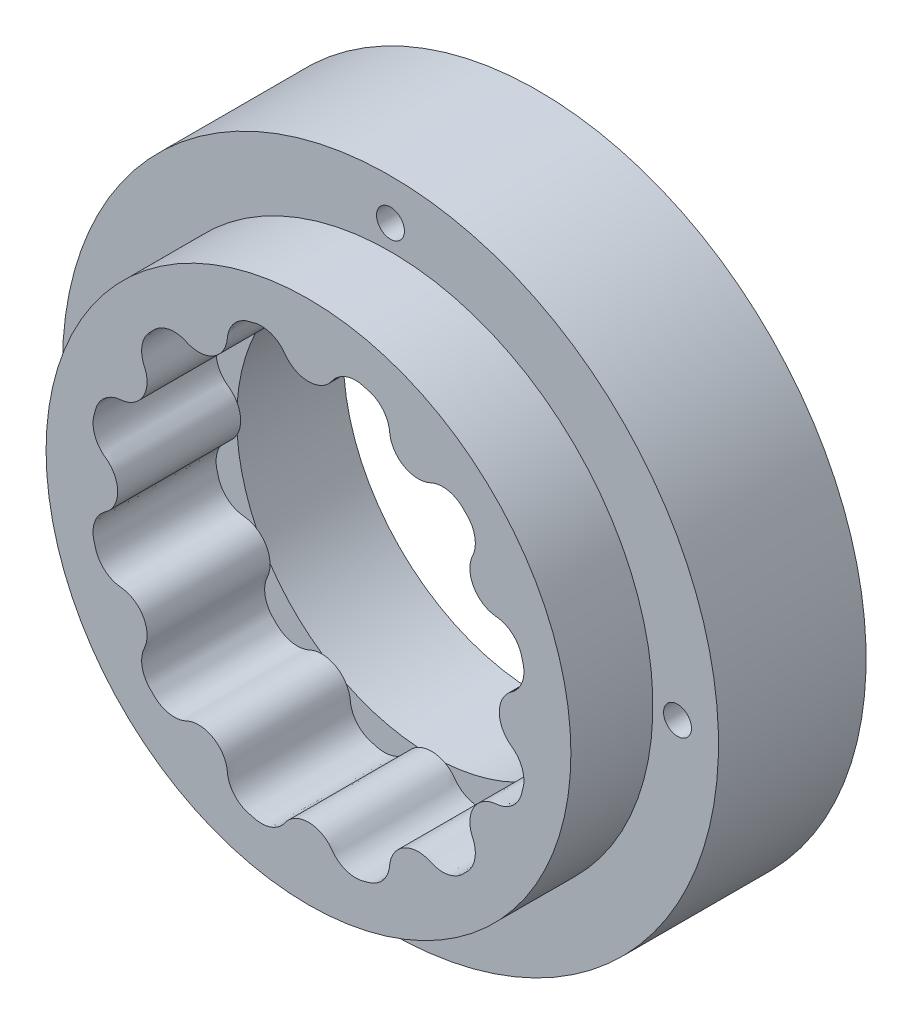
from build123d import *

# Parameters (mm, degrees)
SKETCH1_R           = 32
BOSS_EXTRUDE1_DEPTH = 15
SKETCH3_R           = 40
SKETCH3_R_2         = 30
BOSS_EXTRUDE3_DEPTH = 5
BOSS_EXTRUDE4_START = 13
SKETCH4_R           = 40
SKETCH4_R_2         = 23.75
BOSS_EXTRUDE4_DEPTH = 13
SKETCH5_R           = 1.7
CUT_EXTRUDE1_DEPTH  = 20


with BuildPart() as part:
    # Sketch1 → Boss-Extrude1 (new body)
    with BuildSketch(Plane.XY):
        Circle(SKETCH1_R)
        with BuildLine():
            add(Edge.make_bspline(
                [(7.359163775, -25.96214424), (8.80703283, -25.551734938), (9.765467005, -24.39149163), (9.895150008, -22.892177482), (9.895211407, -22.891467624), (9.895333772, -22.890047872), (9.895515919, -22.887918123), (9.895638291, -22.886498372), (9.895699694, -22.885788515), (10.126492204, -20.21767536), (12.445774365, -18.87863718), (14.871824392, -20.012821581), (14.872469848, -20.013123333), (14.873760575, -20.013727231), (14.875696065, -20.014634362), (14.876986789, -20.015238266), (14.877632243, -20.015540022), (16.224842042, -20.645372719), (17.692884513, -20.407644368), (18.772471398, -19.384826874), (18.779572215, -19.378099449), (18.793717523, -19.364585146), (18.814759116, -19.344129638), (18.828775539, -19.330481949), (18.835780038, -19.323654296), (19.000479487, -19.1631131), (19.1631131, -19.000479487), (19.323654296, -18.835780038), (19.330481949, -18.828775539), (19.344129638, -18.814759116), (19.364585146, -18.793717523), (19.378099449, -18.779572215), (19.384826874, -18.772471398), (20.407644368, -17.692884513), (20.645372719, -16.224842042), (20.015540022, -14.877632243), (20.015238266, -14.876986789), (20.014634362, -14.875696065), (20.013727231, -14.873760575), (20.013123333, -14.872469848), (20.012821581, -14.871824392), (18.87863718, -12.445774365), (20.21767536, -10.126492204), (22.885788515, -9.895699694), (22.886498372, -9.895638291), (22.887918123, -9.895515919), (22.890047872, -9.895333772), (22.891467624, -9.895211407), (22.892177482, -9.895150008), (24.37381174, -9.766996225), (25.526309639, -8.827096198), (25.949850559, -7.401516822), (25.952636335, -7.392140292), (25.958129379, -7.373363908), (25.966124179, -7.345128123), (25.971438913, -7.326300666), (25.974091161, -7.316885495), (26.036454469, -7.095503016), (26.095982503, -6.87334137), (26.152665533, -6.650436865), (26.155076205, -6.640956964), (26.159887239, -6.621994541), (26.167081431, -6.593544234), (26.171712507, -6.574536886), (26.17398822, -6.565023685), (26.519980711, -5.118665271), (25.991838266, -3.728439021), (24.772782251, -2.87663746), (24.772198196, -2.876229358), (24.771029837, -2.87541351), (24.769276494, -2.874190893), (24.768108139, -2.873375039), (24.767524086, -2.872966934), (22.572266569, -1.33903818), (22.572266569, 1.33903818), (24.767524086, 2.872966934), (24.768108139, 2.873375039), (24.769276494, 2.874190893), (24.771029837, 2.87541351), (24.772198196, 2.876229358), (24.772782251, 2.87663746), (25.991838266, 3.728439021), (26.519980711, 5.118665271), (26.17398822, 6.565023685), (26.171712507, 6.574536886), (26.167081431, 6.593544234), (26.159887239, 6.621994541), (26.155076205, 6.640956964), (26.152665533, 6.650436865), (26.095982503, 6.87334137), (26.036454469, 7.095503016), (25.974091161, 7.316885495), (25.971438913, 7.326300666), (25.966124179, 7.345128123), (25.958129379, 7.373363908), (25.952636335, 7.392140292), (25.949850559, 7.401516822), (25.526309639, 8.827096198), (24.37381174, 9.766996225), (22.892177482, 9.895150008), (22.891467624, 9.895211407), (22.890047872, 9.895333772), (22.887918123, 9.895515919), (22.886498372, 9.895638291), (22.885788515, 9.895699694), (20.21767536, 10.126492204), (18.87863718, 12.445774365), (20.012821581, 14.871824392), (20.013123333, 14.872469848), (20.013727231, 14.873760575), (20.014634362, 14.875696065), (20.015238266, 14.876986789), (20.015540022, 14.877632243), (20.645372719, 16.224842042), (20.407644368, 17.692884513), (19.384826874, 18.772471398), (19.378099449, 18.779572215), (19.364585146, 18.793717523), (19.344129638, 18.814759116), (19.330481949, 18.828775539), (19.323654296, 18.835780038), (19.1631131, 19.000479487), (19.000479487, 19.1631131), (18.835780038, 19.323654296), (18.828775539, 19.330481949), (18.814759116, 19.344129638), (18.793717523, 19.364585146), (18.779572215, 19.378099449), (18.772471398, 19.384826874), (17.692884513, 20.407644368), (16.224842042, 20.645372719), (14.877632243, 20.015540022), (14.876986789, 20.015238266), (14.875696065, 20.014634362), (14.873760575, 20.013727231), (14.872469848, 20.013123333), (14.871824392, 20.012821581), (12.445774365, 18.87863718), (10.126492204, 20.21767536), (9.895699694, 22.885788515), (9.895638291, 22.886498372), (9.895515919, 22.887918123), (9.895333772, 22.890047872), (9.895211407, 22.891467624), (9.895150008, 22.892177482), (9.766996225, 24.37381174), (8.827096198, 25.526309639), (7.401516822, 25.949850559), (7.392140292, 25.952636335), (7.373363908, 25.958129379), (7.345128123, 25.966124179), (7.326300666, 25.971438913), (7.316885495, 25.974091161), (7.095503016, 26.036454469), (6.87334137, 26.095982503), (6.650436865, 26.152665533), (6.640956964, 26.155076205), (6.621994541, 26.159887239), (6.593544234, 26.167081431), (6.574536886, 26.171712507), (6.565023685, 26.17398822), (5.118665271, 26.519980711), (3.728439021, 25.991838266), (2.87663746, 24.772782251), (2.876229358, 24.772198196), (2.87541351, 24.771029837), (2.874190893, 24.769276494), (2.873375039, 24.768108139), (2.872966934, 24.767524086), (1.33903818, 22.572266569), (-1.33903818, 22.572266569), (-2.872966934, 24.767524086), (-2.873375039, 24.768108139), (-2.874190893, 24.769276494), (-2.87541351, 24.771029837), (-2.876229358, 24.772198196), (-2.87663746, 24.772782251), (-3.728439021, 25.991838266), (-5.118665271, 26.519980711), (-6.565023685, 26.17398822), (-6.574536886, 26.171712507), (-6.593544234, 26.167081431), (-6.621994541, 26.159887239), (-6.640956964, 26.155076205), (-6.650436865, 26.152665533), (-6.87334137, 26.095982503), (-7.095503016, 26.036454469), (-7.316885495, 25.974091161), (-7.326300666, 25.971438913), (-7.345128123, 25.966124179), (-7.373363908, 25.958129379), (-7.392140292, 25.952636335), (-7.401516822, 25.949850559), (-8.827096198, 25.526309639), (-9.766996225, 24.37381174), (-9.895150008, 22.892177482), (-9.895211407, 22.891467624), (-9.895333772, 22.890047872), (-9.895515919, 22.887918123), (-9.895638291, 22.886498372), (-9.895699694, 22.885788515), (-10.126492204, 20.21767536), (-12.445774365, 18.87863718), (-14.871824392, 20.012821581), (-14.872469848, 20.013123333), (-14.873760575, 20.013727231), (-14.875696065, 20.014634362), (-14.876986789, 20.015238266), (-14.877632243, 20.015540022), (-16.224842042, 20.645372719), (-17.692884513, 20.407644368), (-18.772471398, 19.384826874), (-18.779572215, 19.378099449), (-18.793717523, 19.364585146), (-18.814759116, 19.344129638), (-18.828775539, 19.330481949), (-18.835780038, 19.323654296), (-19.000479487, 19.1631131), (-19.1631131, 19.000479487), (-19.323654296, 18.835780038), (-19.330481949, 18.828775539), (-19.344129638, 18.814759116), (-19.364585146, 18.793717523), (-19.378099449, 18.779572215), (-19.384826874, 18.772471398), (-20.407644368, 17.692884513), (-20.645372719, 16.224842042), (-20.015540022, 14.877632243), (-20.015238266, 14.876986789), (-20.014634362, 14.875696065), (-20.013727231, 14.873760575), (-20.013123333, 14.872469848), (-20.012821581, 14.871824392), (-18.87863718, 12.445774365), (-20.21767536, 10.126492204), (-22.885788515, 9.895699694), (-22.886498372, 9.895638291), (-22.887918123, 9.895515919), (-22.890047872, 9.895333772), (-22.891467624, 9.895211407), (-22.892177482, 9.895150008), (-24.37381174, 9.766996225), (-25.526309639, 8.827096198), (-25.949850559, 7.401516822), (-25.952636335, 7.392140292), (-25.958129379, 7.373363908), (-25.966124179, 7.345128123), (-25.971438913, 7.326300666), (-25.974091161, 7.316885495), (-26.036454469, 7.095503016), (-26.095982503, 6.87334137), (-26.152665533, 6.650436865), (-26.155076205, 6.640956964), (-26.159887239, 6.621994541), (-26.167081431, 6.593544234), (-26.171712507, 6.574536886), (-26.17398822, 6.565023685), (-26.519980711, 5.118665271), (-25.991838266, 3.728439021), (-24.772782251, 2.87663746), (-24.772198196, 2.876229358), (-24.771029837, 2.87541351), (-24.769276494, 2.874190893), (-24.768108139, 2.873375039), (-24.767524086, 2.872966934), (-22.572266569, 1.33903818), (-22.572266569, -1.33903818), (-24.767524086, -2.872966934), (-24.768108139, -2.873375039), (-24.769276494, -2.874190893), (-24.771029837, -2.87541351), (-24.772198196, -2.876229358), (-24.772782251, -2.87663746), (-25.991838266, -3.728439021), (-26.519980711, -5.118665271), (-26.17398822, -6.565023685), (-26.171712507, -6.574536886), (-26.167081431, -6.593544234), (-26.159887239, -6.621994541), (-26.155076205, -6.640956964), (-26.152665533, -6.650436865), (-26.095982503, -6.87334137), (-26.036454469, -7.095503016), (-25.974091161, -7.316885495), (-25.971438913, -7.326300666), (-25.966124179, -7.345128123), (-25.958129379, -7.373363908), (-25.952636335, -7.392140292), (-25.949850559, -7.401516822), (-25.526309639, -8.827096198), (-24.37381174, -9.766996225), (-22.892177482, -9.895150008), (-22.891467624, -9.895211407), (-22.890047872, -9.895333772), (-22.887918123, -9.895515919), (-22.886498372, -9.895638291), (-22.885788515, -9.895699694), (-20.21767536, -10.126492204), (-18.87863718, -12.445774365), (-20.012821581, -14.871824392), (-20.013123333, -14.872469848), (-20.013727231, -14.873760575), (-20.014634362, -14.875696065), (-20.015238266, -14.876986789), (-20.015540022, -14.877632243), (-20.645372719, -16.224842042), (-20.407644368, -17.692884513), (-19.384826874, -18.772471398), (-19.378099449, -18.779572215), (-19.364585146, -18.793717523), (-19.344129638, -18.814759116), (-19.330481949, -18.828775539), (-19.323654296, -18.835780038), (-19.1631131, -19.000479487), (-19.000479487, -19.1631131), (-18.835780038, -19.323654296), (-18.828775539, -19.330481949), (-18.814759116, -19.344129638), (-18.793717523, -19.364585146), (-18.779572215, -19.378099449), (-18.772471398, -19.384826874), (-17.692884513, -20.407644368), (-16.224842042, -20.645372719), (-14.877632243, -20.015540022), (-14.876986789, -20.015238266), (-14.875696065, -20.014634362), (-14.873760575, -20.013727231), (-14.872469848, -20.013123333), (-14.871824392, -20.012821581), (-12.445774365, -18.87863718), (-10.126492204, -20.21767536), (-9.895699694, -22.885788515), (-9.895638291, -22.886498372), (-9.895515919, -22.887918123), (-9.895333772, -22.890047872), (-9.895211407, -22.891467624), (-9.895150008, -22.892177482), (-9.766996225, -24.37381174), (-8.827096198, -25.526309639), (-7.401516822, -25.949850559), (-7.392140292, -25.952636335), (-7.373363908, -25.958129379), (-7.345128123, -25.966124179), (-7.326300666, -25.971438913), (-7.316885495, -25.974091161), (-7.095503016, -26.036454469), (-6.87334137, -26.095982503), (-6.650436865, -26.152665533), (-6.640956964, -26.155076205), (-6.621994541, -26.159887239), (-6.593544234, -26.167081431), (-6.574536886, -26.171712507), (-6.565023685, -26.17398822), (-5.118665271, -26.519980711), (-3.728439021, -25.991838266), (-2.87663746, -24.772782251), (-2.876229358, -24.772198196), (-2.87541351, -24.771029837), (-2.874190893, -24.769276494), (-2.873375039, -24.768108139), (-2.872966934, -24.767524086), (-1.33903818, -22.572266569), (1.33903818, -22.572266569), (2.872966934, -24.767524086), (2.873375039, -24.768108139), (2.874190893, -24.769276494), (2.87541351, -24.771029837), (2.876229358, -24.772198196), (2.87663746, -24.772782251), (3.738603309, -26.00638489), (5.148753306, -26.531967982), (6.60784934, -26.163458336), (6.691642424, -26.142295535), (6.857663059, -26.093771287), (7.107975223, -26.026700345), (7.276015435, -25.985713258), (7.359163775, -25.96214424)],
                knots=[0, 0, 0, 0, 0.022861669, 0.022861669, 0.022861669, 0.022873941, 0.022886214, 0.022898486, 0.022898486, 0.022898486, 0.055887763, 0.055887763, 0.055887763, 0.055900036, 0.055912308, 0.05592458, 0.05592458, 0.05592458, 0.078577418, 0.078577418, 0.078577418, 0.078745896, 0.078914374, 0.079082852, 0.079082852, 0.079082852, 0.083044128, 0.083044128, 0.083044128, 0.083212606, 0.083381085, 0.083549563, 0.083549563, 0.083549563, 0.1062024, 0.1062024, 0.1062024, 0.106214673, 0.106226945, 0.106239217, 0.106239217, 0.106239217, 0.139228495, 0.139228495, 0.139228495, 0.139240767, 0.139253039, 0.139265311, 0.139265311, 0.139265311, 0.161918149, 0.161918149, 0.161918149, 0.162086627, 0.162255106, 0.162423584, 0.162423584, 0.162423584, 0.16638486, 0.16638486, 0.16638486, 0.166553338, 0.166721816, 0.166890294, 0.166890294, 0.166890294, 0.189543132, 0.189543132, 0.189543132, 0.189555404, 0.189567676, 0.189579948, 0.189579948, 0.189579948, 0.222569226, 0.222569226, 0.222569226, 0.222581498, 0.222593771, 0.222606043, 0.222606043, 0.222606043, 0.24525888, 0.24525888, 0.24525888, 0.245427359, 0.245595837, 0.245764315, 0.245764315, 0.245764315, 0.249725591, 0.249725591, 0.249725591, 0.249894069, 0.250062547, 0.250231025, 0.250231025, 0.250231025, 0.272883863, 0.272883863, 0.272883863, 0.272896135, 0.272908408, 0.27292068, 0.27292068, 0.27292068, 0.305909957, 0.305909957, 0.305909957, 0.30592223, 0.305934502, 0.305946774, 0.305946774, 0.305946774, 0.328599612, 0.328599612, 0.328599612, 0.32876809, 0.328936568, 0.329105046, 0.329105046, 0.329105046, 0.333066322, 0.333066322, 0.333066322, 0.3332348, 0.333403279, 0.333571757, 0.333571757, 0.333571757, 0.356224594, 0.356224594, 0.356224594, 0.356236867, 0.356249139, 0.356261411, 0.356261411, 0.356261411, 0.389250689, 0.389250689, 0.389250689, 0.389262961, 0.389275233, 0.389287505, 0.389287505, 0.389287505, 0.411940343, 0.411940343, 0.411940343, 0.412108821, 0.4122773, 0.412445778, 0.412445778, 0.412445778, 0.416407054, 0.416407054, 0.416407054, 0.416575532, 0.41674401, 0.416912488, 0.416912488, 0.416912488, 0.439565326, 0.439565326, 0.439565326, 0.439577598, 0.43958987, 0.439602142, 0.439602142, 0.439602142, 0.47259142, 0.47259142, 0.47259142, 0.472603692, 0.472615965, 0.472628237, 0.472628237, 0.472628237, 0.495281074, 0.495281074, 0.495281074, 0.495449553, 0.495618031, 0.495786509, 0.495786509, 0.495786509, 0.499747785, 0.499747785, 0.499747785, 0.499916263, 0.500084741, 0.500253219, 0.500253219, 0.500253219, 0.522906057, 0.522906057, 0.522906057, 0.522918329, 0.522930602, 0.522942874, 0.522942874, 0.522942874, 0.555932151, 0.555932151, 0.555932151, 0.555944424, 0.555956696, 0.555968968, 0.555968968, 0.555968968, 0.578621806, 0.578621806, 0.578621806, 0.578790284, 0.578958762, 0.57912724, 0.57912724, 0.57912724, 0.583088516, 0.583088516, 0.583088516, 0.583256994, 0.583425473, 0.583593951, 0.583593951, 0.583593951, 0.606246788, 0.606246788, 0.606246788, 0.606259061, 0.606271333, 0.606283605, 0.606283605, 0.606283605, 0.639272883, 0.639272883, 0.639272883, 0.639285155, 0.639297427, 0.639309699, 0.639309699, 0.639309699, 0.661962537, 0.661962537, 0.661962537, 0.662131015, 0.662299493, 0.662467972, 0.662467972, 0.662467972, 0.666429248, 0.666429248, 0.666429248, 0.666597726, 0.666766204, 0.666934682, 0.666934682, 0.666934682, 0.68958752, 0.68958752, 0.68958752, 0.689599792, 0.689612064, 0.689624336, 0.689624336, 0.689624336, 0.722613614, 0.722613614, 0.722613614, 0.722625886, 0.722638159, 0.722650431, 0.722650431, 0.722650431, 0.745303268, 0.745303268, 0.745303268, 0.745471747, 0.745640225, 0.745808703, 0.745808703, 0.745808703, 0.749769979, 0.749769979, 0.749769979, 0.749938457, 0.750106935, 0.750275413, 0.750275413, 0.750275413, 0.772928251, 0.772928251, 0.772928251, 0.772940523, 0.772952796, 0.772965068, 0.772965068, 0.772965068, 0.805954345, 0.805954345, 0.805954345, 0.805966618, 0.80597889, 0.805991162, 0.805991162, 0.805991162, 0.828644, 0.828644, 0.828644, 0.828812478, 0.828980956, 0.829149434, 0.829149434, 0.829149434, 0.83311071, 0.83311071, 0.83311071, 0.833279188, 0.833447667, 0.833616145, 0.833616145, 0.833616145, 0.856268982, 0.856268982, 0.856268982, 0.856281255, 0.856293527, 0.856305799, 0.856305799, 0.856305799, 0.889295077, 0.889295077, 0.889295077, 0.889307349, 0.889319621, 0.889331893, 0.889331893, 0.889331893, 0.911984731, 0.911984731, 0.911984731, 0.912153209, 0.912321687, 0.912490166, 0.912490166, 0.912490166, 0.916451442, 0.916451442, 0.916451442, 0.91661992, 0.916788398, 0.916956876, 0.916956876, 0.916956876, 0.939609714, 0.939609714, 0.939609714, 0.939621986, 0.939634258, 0.93964653, 0.93964653, 0.93964653, 0.972635808, 0.972635808, 0.972635808, 0.97264808, 0.972660353, 0.972672625, 0.972672625, 0.972672625, 0.995534294, 0.995534294, 0.995534294, 0.997022863, 0.998511431, 1, 1, 1, 1], degree=3, weights=[1, 0.881989361, 0.881989361, 1, 1, 1, 1, 1, 1, 0.715181732, 0.715181732, 1, 1, 1, 1, 1, 1, 0.884361143, 0.884361143, 1, 1, 1, 1, 1, 1, 0.99994552, 0.99994552, 1, 1, 1, 1, 1, 1, 0.884361143, 0.884361143, 1, 1, 1, 1, 1, 1, 0.715181732, 0.715181732, 1, 1, 1, 1, 1, 1, 0.884361143, 0.884361143, 1, 1, 1, 1, 1, 1, 0.99994552, 0.99994552, 1, 1, 1, 1, 1, 1, 0.884361143, 0.884361143, 1, 1, 1, 1, 1, 1, 0.715181732, 0.715181732, 1, 1, 1, 1, 1, 1, 0.884361143, 0.884361143, 1, 1, 1, 1, 1, 1, 0.99994552, 0.99994552, 1, 1, 1, 1, 1, 1, 0.884361143, 0.884361143, 1, 1, 1, 1, 1, 1, 0.715181732, 0.715181732, 1, 1, 1, 1, 1, 1, 0.884361143, 0.884361143, 1, 1, 1, 1, 1, 1, 0.99994552, 0.99994552, 1, 1, 1, 1, 1, 1, 0.884361143, 0.884361143, 1, 1, 1, 1, 1, 1, 0.715181732, 0.715181732, 1, 1, 1, 1, 1, 1, 0.884361143, 0.884361143, 1, 1, 1, 1, 1, 1, 0.99994552, 0.99994552, 1, 1, 1, 1, 1, 1, 0.884361143, 0.884361143, 1, 1, 1, 1, 1, 1, 0.715181732, 0.715181732, 1, 1, 1, 1, 1, 1, 0.884361143, 0.884361143, 1, 1, 1, 1, 1, 1, 0.99994552, 0.99994552, 1, 1, 1, 1, 1, 1, 0.884361143, 0.884361143, 1, 1, 1, 1, 1, 1, 0.715181732, 0.715181732, 1, 1, 1, 1, 1, 1, 0.884361143, 0.884361143, 1, 1, 1, 1, 1, 1, 0.99994552, 0.99994552, 1, 1, 1, 1, 1, 1, 0.884361143, 0.884361143, 1, 1, 1, 1, 1, 1, 0.715181732, 0.715181732, 1, 1, 1, 1, 1, 1, 0.884361143, 0.884361143, 1, 1, 1, 1, 1, 1, 0.99994552, 0.99994552, 1, 1, 1, 1, 1, 1, 0.884361143, 0.884361143, 1, 1, 1, 1, 1, 1, 0.715181732, 0.715181732, 1, 1, 1, 1, 1, 1, 0.884361143, 0.884361143, 1, 1, 1, 1, 1, 1, 0.99994552, 0.99994552, 1, 1, 1, 1, 1, 1, 0.884361143, 0.884361143, 1, 1, 1, 1, 1, 1, 0.715181732, 0.715181732, 1, 1, 1, 1, 1, 1, 0.884361143, 0.884361143, 1, 1, 1, 1, 1, 1, 0.99994552, 0.99994552, 1, 1, 1, 1, 1, 1, 0.884361143, 0.884361143, 1, 1, 1, 1, 1, 1, 0.715181732, 0.715181732, 1, 1, 1, 1, 1, 1, 0.884361143, 0.884361143, 1, 1, 1, 1, 1, 1, 0.99994552, 0.99994552, 1, 1, 1, 1, 1, 1, 0.884361143, 0.884361143, 1, 1, 1, 1, 1, 1, 0.715181732, 0.715181732, 1, 1, 1, 1, 1, 1, 0.881989361, 0.881989361, 1, 1, 1, 1, 1, 1]))
        make_face(mode=Mode.SUBTRACT)
    extrude(amount=BOSS_EXTRUDE1_DEPTH)

    # Sketch3 → Boss-Extrude3 (add)
    with BuildSketch(Plane(origin=(0, 0, 0), x_dir=(-1, 0, 0), z_dir=(0, 0, -1))):
        Circle(SKETCH3_R)
        Circle(SKETCH3_R_2, mode=Mode.SUBTRACT)
    extrude(amount=-BOSS_EXTRUDE3_DEPTH)

    # Sketch4 → Boss-Extrude4 (add)
    with BuildSketch(Plane(origin=(0, 0, 0), x_dir=(-1, 0, 0), z_dir=(0, 0, -1)).offset(BOSS_EXTRUDE4_START)):
        Circle(SKETCH4_R)
        Circle(SKETCH4_R_2, mode=Mode.SUBTRACT)
    extrude(amount=-BOSS_EXTRUDE4_DEPTH)

    # Sketch5 → Cut-Extrude1 (cut)
    with BuildSketch(Plane(origin=(0, 0, -13), x_dir=(-1, 0, 0), z_dir=(0, 0, -1))):
        with Locations((0, 35)):
            Circle(SKETCH5_R)
        with Locations((35, 0)):
            Circle(SKETCH5_R)
        with Locations((0, -35)):
            Circle(SKETCH5_R)
        with Locations((-35, 0)):
            Circle(SKETCH5_R)
    extrude(amount=-CUT_EXTRUDE1_DEPTH, mode=Mode.SUBTRACT)


solid = part.part
